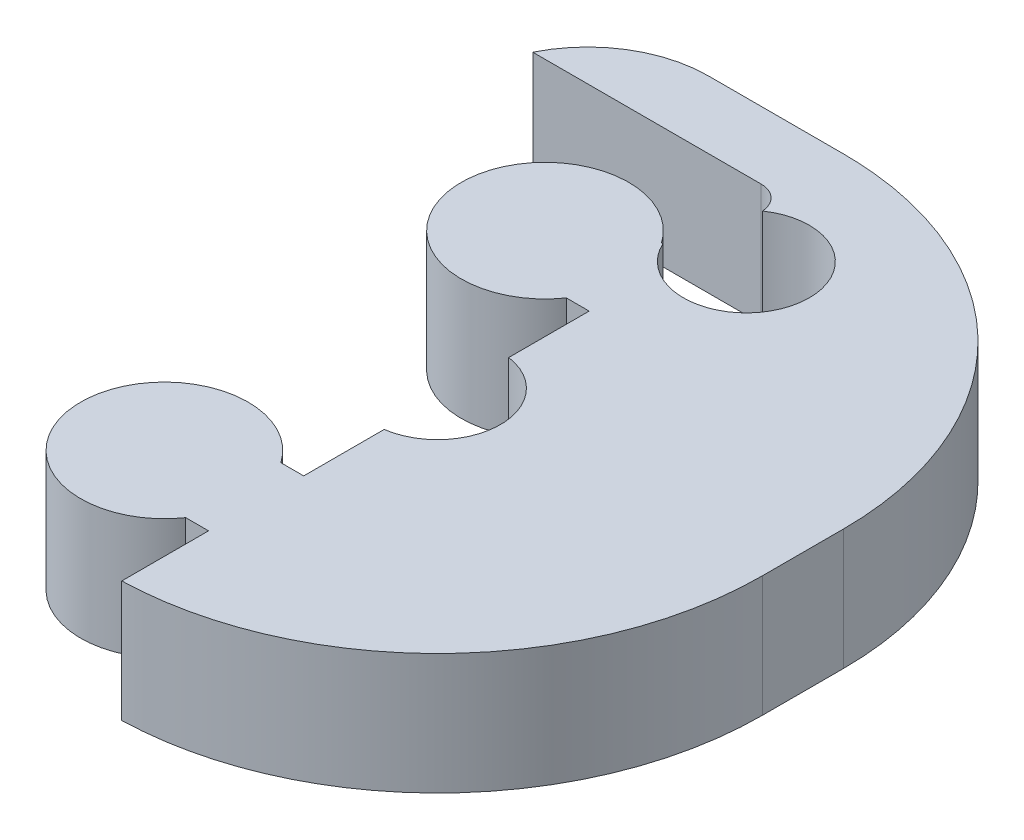
from build123d import *

# Parameters (mm, degrees)
SKETCH1_W           = 50.8
SKETCH1_H           = 22.86
BOSS_EXTRUDE1_DEPTH = 3.175
FILLET1_R           = 10.16
SKETCH3_R           = 1.9685
CUT_EXTRUDE1_DEPTH  = 29.033649869
FILLET3_R           = 10.16
SCALE1_SCALE_X      = 0.84
SCALE1_SCALE_Y      = 1
SCALE1_SCALE_Z      = 0.84
CUT_EXTRUDE2_DEPTH  = 24.662282921
FILLET4_R           = 3.175
FILLET5_DEPTH       = 3.175


with BuildPart() as part:
    # Sketch1 → Boss-Extrude1 (new body)
    with BuildSketch(Plane(origin=(0, 0, 0), x_dir=(1, 0, 0), z_dir=(0, 1, 0))):
        Rectangle(SKETCH1_W, SKETCH1_H)
    extrude(amount=BOSS_EXTRUDE1_DEPTH)

    # Fillet1
    fillet1_edges = [part.edges().sort_by_distance(p)[0] for p in [
        (25.4, 1.5875, 11.43),
        (-25.4, 1.5875, 11.43),
    ]]
    fillet(fillet1_edges, radius=FILLET1_R)

    # Sketch3 → Cut-Extrude1 (cut, through all)
    with BuildSketch(Plane(origin=(0, 3.175, 0), x_dir=(1, 0, 0), z_dir=(0, 1, 0))):
        with Locations(Location((15.24, -1.27, 0), (0, 0, 270))):
            Circle(SKETCH3_R)
        with Locations(Location((16.637, 6.994763457, 0), (0, 0, 270))):
            Circle(SKETCH3_R)
        with Locations(Location((-3.81, -1.27, 0), (0, 0, 270))):
            Circle(SKETCH3_R)
    extrude(amount=-CUT_EXTRUDE1_DEPTH, mode=Mode.SUBTRACT)

    # Fillet3
    fillet3_edges = [part.edges().sort_by_distance(p)[0] for p in [
        (-25.4, 1.5875, -11.43),
        (25.4, 1.5875, -11.43),
    ]]
    fillet(fillet3_edges, radius=FILLET3_R)


with BuildPart() as part_1:
    # Scale1: scaled about (-0.329754669, 1.5875, 0.052338299)
    add(part.part.scale((SCALE1_SCALE_X, SCALE1_SCALE_Y, SCALE1_SCALE_Z), about=(-0.329754669, 1.5875, 0.052338299)))

    # Sketch4 → Cut-Extrude2 (cut, through all)
    with BuildSketch(Plane(origin=(0, 3.175, 0), x_dir=(1, 0, 0), z_dir=(0, 1, 0))):
        with BuildLine():
            Line((12.984828754, -7.325177491), (12.984828754, -9.609574128))
            Line((12.984828754, -9.609574128), (-21.388760747, -9.609574128))
            Line((-21.388760747, -9.609574128), (-21.388760747, 9.592825872))
            Line((-21.388760747, 9.592825872), (6.353119253, 9.592825872))
            Line((6.353119253, 9.592825872), (6.353119253, 7.824824044))
            Line((6.353119253, 7.824824044), (12.984828754, 7.824824044))
            Line((12.984828754, 7.824824044), (12.984828754, 5.174822509))
            Line((12.984828754, 5.174822509), (12.384828754, 5.174822509))
            ThreePointArc((12.384828754, 5.174822509), (8.374442055, 3.924822509), (12.384828754, 2.674822509))
            Line((12.384828754, 2.674822509), (12.984828754, 2.674822509))
            Line((12.984828754, 2.674822509), (12.984828754, -4.825177491))
            Line((12.984828754, -4.825177491), (12.384828754, -4.825177491))
            ThreePointArc((12.384828754, -4.825177491), (8.374442055, -6.075177491), (12.384828754, -7.325177491))
            Line((12.384828754, -7.325177491), (12.984828754, -7.325177491))
        make_face()
    extrude(amount=-CUT_EXTRUDE2_DEPTH, mode=Mode.SUBTRACT)

    # Fillet4
    # the kernel refuses this fillet: 3.175 mm, written as the material it takes off along each edge
    with BuildSketch(Plane(origin=(6.353119253, 10.290555646, -9.592825872), x_dir=(1.0, 0, -2.4331567057805564e-11), z_dir=(0, -1, 0))) as fillet4_piece_1:
        with BuildLine():
            CenterArc((2.846222258, 3.175), FILLET4_R, 206.304974961, 63.695025041)
            Line((0, 1.768001828), (-0.056924445, 1.739861865))
            ThreePointArc((-0.056924445, 1.739861865), (-0.0635, 0.884000914), (-0.0635, 0))
            Line((-0.0635, 0), (0, -0.0635))
            Line((0, -0.0635), (2.846222258, -0.0635))
            Line((2.846222258, -0.0635), (2.846222258, 0))
        make_face()
    extrude(amount=17.406111292, mode=Mode.SUBTRACT)

    # Fillet5: read off the stored shape, not the designer's step
    # Fillet5 outline → Fillet5 (add)
    with BuildSketch(Plane(origin=(0, 0, 0), x_dir=(1, 0, 0), z_dir=(0, 1, 0))):
        with BuildLine():
            ThreePointArc((12.351058447, 7.824824044), (12.785881926, 7.65259131), (12.984828754, 7.22932339))
            Line((12.984828754, 7.22932339), (12.984828754, 7.824824044))
            Line((12.984828754, 7.824824044), (12.351058447, 7.824824044))
        make_face()
    extrude(amount=FILLET5_DEPTH)


solid = part_1.part
